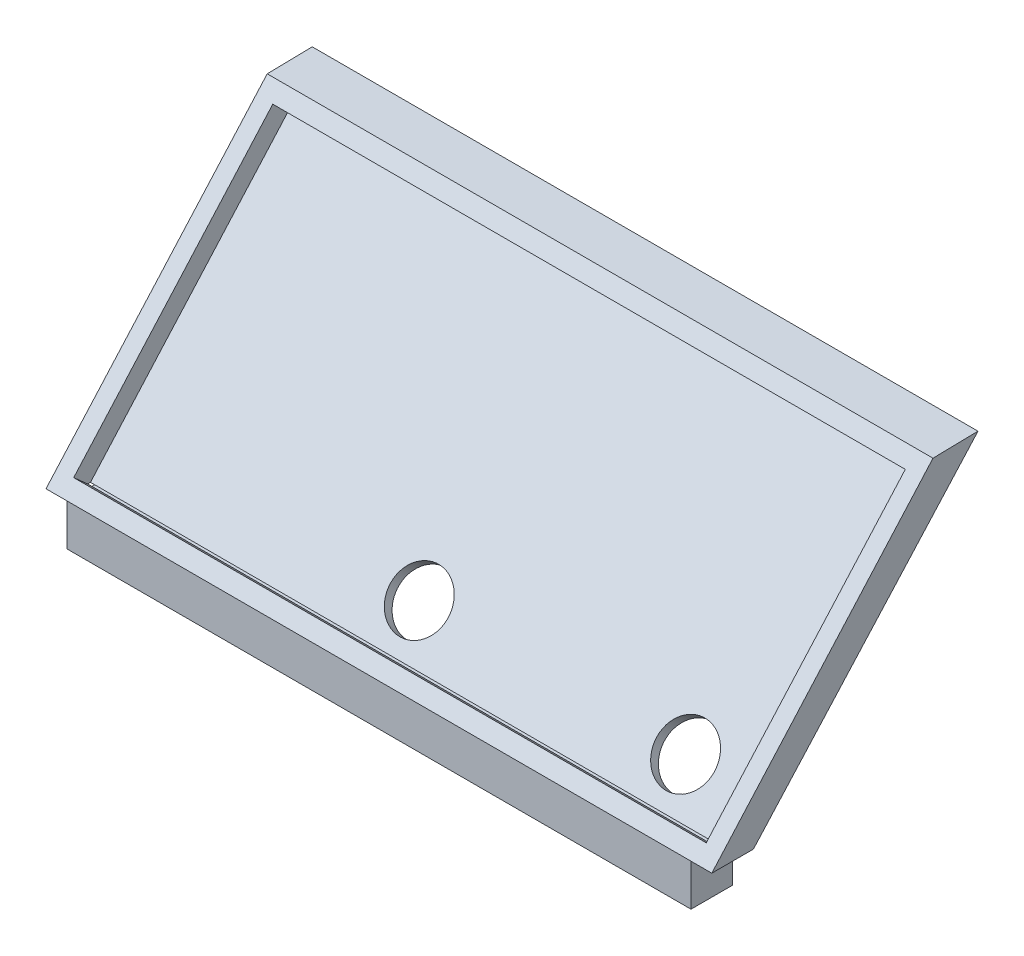
from build123d import *

# Parameters (mm, degrees)
SKETCH1_W            = 101.6
SKETCH1_H            = 50.8
BOSS_EXTRUDE1_DEPTH  = 228.6
SKETCH2_W            = 96.52
SKETCH2_H            = 172.72
CUT_EXTRUDE1_DEPTH   = 50.8
BOSS_EXTRUDE2_DEPTH  = 50.8
BOSS_EXTRUDE3_DEPTH  = 101.6
SKETCH13_W           = 96.52
SKETCH13_H           = 25.4
CUT_EXTRUDE2_DEPTH   = 50.8
SKETCH14_W           = 96.52
SKETCH14_H           = 25.4
CUT_EXTRUDE3_DEPTH   = 50.8
SKETCH15_W           = 96.52
SKETCH15_H           = 50.8
CUT_EXTRUDE6_DEPTH   = 6.35
SKETCH16_W           = 96.52
SKETCH16_H           = 45.72
CUT_EXTRUDE7_DEPTH   = 3.175
SKETCH17_W           = 101.6
SKETCH17_H           = 25.4
CUT_EXTRUDE8_DEPTH   = 228.6
SKETCH20_W           = 6.35
SKETCH20_H           = 12.7
BOSS_EXTRUDE5_DEPTH  = 101.6
SKETCH24_W           = 12.7
SKETCH24_H           = 6.35
BOSS_EXTRUDE8_DEPTH  = 19.05
SKETCH26_W           = 12.7
SKETCH26_H           = 6.35
BOSS_EXTRUDE10_DEPTH = 19.05
SKETCH27_W           = 12.7
SKETCH27_H           = 6.35
BOSS_EXTRUDE11_DEPTH = 19.05
SKETCH33_W           = 96.52
SKETCH33_H           = 2.54
BOSS_EXTRUDE13_DEPTH = 2.54
SKETCH34_W           = 96.52
SKETCH34_H           = 2.54
BOSS_EXTRUDE17_DEPTH = 2.54
SKETCH36_W           = 218.44
SKETCH36_H           = 2.54
BOSS_EXTRUDE18_DEPTH = 2.54
SKETCH37_W           = 218.44
SKETCH37_H           = 2.54
BOSS_EXTRUDE19_DEPTH = 2.54
SKETCH45_W           = 13.208
SKETCH45_H           = 10.16
CUT_EXTRUDE19_DEPTH  = 6.35
CUT_EXTRUDE22_START  = -101.6
CUT_EXTRUDE22_DEPTH  = 101.6
SKETCH60_R           = 4.445
CUT_EXTRUDE23_DEPTH  = 2.54
SKETCH61_R           = 4.445
CUT_EXTRUDE24_DEPTH  = 2.54
SKETCH64_W           = 95.25
SKETCH64_H           = 6.35
BOSS_EXTRUDE33_DEPTH = 6.35


# Read off the part's stored shape, not the designer's step: Cut-Extrude22
with BuildPart() as part:
    # Sketch1 → Boss-Extrude1 (new body)
    with BuildSketch(Plane.XY):
        Rectangle(SKETCH1_W, SKETCH1_H)
    extrude(amount=-BOSS_EXTRUDE1_DEPTH)

    # Sketch2 → Cut-Extrude1 (cut)
    with BuildSketch(Plane(origin=(0, 25.4, 0), x_dir=(1, 0, 0), z_dir=(0, 1, 0))):
        with Locations((0, 114.3)):
            Rectangle(SKETCH2_W, SKETCH2_H)
    extrude(amount=-CUT_EXTRUDE1_DEPTH, mode=Mode.SUBTRACT)

    # Sketch3 → Boss-Extrude2 (add)
    with BuildSketch(Plane(origin=(0, 25.4, 0), x_dir=(1, 0, 0), z_dir=(0, 1, 0))):
        Polygon((48.26, 73.001295984), (48.26, 79.351295984), (-48.26, 79.351295984), (-48.26, 73.001295984), (0, 73.001295984), align=None)
    extrude(amount=-BOSS_EXTRUDE2_DEPTH)

    # Sketch11 → Boss-Extrude3 (add)
    with BuildSketch(Plane.ZY.offset(50.8)):
        Polygon((-79.351295984, 25.4), (-113.622558301, 63.5), (-106.756614843, 63.363382999), (-73.001295984, 25.4), align=None)
    extrude(amount=-BOSS_EXTRUDE3_DEPTH)

    # Sketch13 → Cut-Extrude2 (cut)
    with BuildSketch(Plane(origin=(0, 25.4, 0), x_dir=(1, 0, 0), z_dir=(0, 1, 0))):
        with Locations((0, 213.36)):
            Rectangle(SKETCH13_W, SKETCH13_H)
    extrude(amount=-CUT_EXTRUDE2_DEPTH, mode=Mode.SUBTRACT)

    # Sketch14 → Cut-Extrude3 (cut)
    with BuildSketch(Plane(origin=(0, 25.4, 0), x_dir=(1, 0, 0), z_dir=(0, 1, 0))):
        with Locations((0, 15.24)):
            Rectangle(SKETCH14_W, SKETCH14_H)
    extrude(amount=-CUT_EXTRUDE3_DEPTH, mode=Mode.SUBTRACT)

    # Sketch15 → Cut-Extrude6 (cut)
    with BuildSketch(Plane.XY.offset(-73.001295984)):
        Rectangle(SKETCH15_W, SKETCH15_H)
    extrude(amount=-CUT_EXTRUDE6_DEPTH, mode=Mode.SUBTRACT)

    # Sketch16 → Cut-Extrude7 (cut)
    with BuildSketch(Plane(origin=(0, -25.035409247, -28.156416881), x_dir=(1, 0, 0), z_dir=(0, 0.6644747806949454, 0.7473106889509907))):
        with Locations((0, 92.889211639)):
            Rectangle(SKETCH16_W, SKETCH16_H)
    extrude(amount=-CUT_EXTRUDE7_DEPTH, mode=Mode.SUBTRACT)

    # Sketch17 → Cut-Extrude8 (cut)
    with BuildSketch(Plane.XY):
        with Locations((0, -12.7)):
            Rectangle(SKETCH17_W, SKETCH17_H)
    extrude(amount=-CUT_EXTRUDE8_DEPTH, mode=Mode.SUBTRACT)

    # Sketch20 → Boss-Extrude5 (add)
    with BuildSketch(Plane.ZY.offset(50.8)):
        with Locations((-174.625, 6.35)):
            Rectangle(SKETCH20_W, SKETCH20_H)
    extrude(amount=-BOSS_EXTRUDE5_DEPTH)

    # Sketch24 → Boss-Extrude8 (add)
    with BuildSketch(Plane.XZ):
        with Locations((44.45, -76.176295984)):
            Rectangle(SKETCH24_W, SKETCH24_H)
    extrude(amount=BOSS_EXTRUDE8_DEPTH)

    # Sketch26 → Boss-Extrude10 (add)
    with BuildSketch(Plane.XZ):
        with Locations((-44.45, -174.625)):
            Rectangle(SKETCH26_W, SKETCH26_H)
    extrude(amount=BOSS_EXTRUDE10_DEPTH)

    # Sketch27 → Boss-Extrude11 (add)
    with BuildSketch(Plane.XZ):
        with Locations((44.45, -174.625)):
            Rectangle(SKETCH27_W, SKETCH27_H)
    extrude(amount=BOSS_EXTRUDE11_DEPTH)

    # Sketch33 → Boss-Extrude13 (add)
    with BuildSketch(Plane(origin=(0, 0, -2.54), x_dir=(-1, 0, 0), z_dir=(0, 0, -1))):
        with Locations((0, 12.7)):
            Rectangle(SKETCH33_W, SKETCH33_H)
    extrude(amount=BOSS_EXTRUDE13_DEPTH)

    # Sketch34 → Boss-Extrude17 (add)
    with BuildSketch(Plane.XY.offset(-226.06)):
        with Locations((0, 12.7)):
            Rectangle(SKETCH34_W, SKETCH34_H)
    extrude(amount=BOSS_EXTRUDE17_DEPTH)

    # Sketch36 → Boss-Extrude18 (add)
    with BuildSketch(Plane(origin=(-48.26, 0, 0), x_dir=(0, 0, -1), z_dir=(1, 0, 0))):
        with Locations((114.3, 12.7)):
            Rectangle(SKETCH36_W, SKETCH36_H)
    extrude(amount=BOSS_EXTRUDE18_DEPTH)

    # Sketch37 → Boss-Extrude19 (add)
    with BuildSketch(Plane.ZY.offset(-48.26)):
        with Locations((-114.3, 12.7)):
            Rectangle(SKETCH37_W, SKETCH37_H)
    extrude(amount=BOSS_EXTRUDE19_DEPTH)

    # Sketch45 → Cut-Extrude19 (cut)
    with BuildSketch(Plane.XY):
        with Locations((37.933039121, 12.7)):
            Rectangle(SKETCH45_W, SKETCH45_H)
        with Locations((-37.933039121, 12.7)):
            Rectangle(SKETCH45_W, SKETCH45_H)
    extrude(amount=-CUT_EXTRUDE19_DEPTH, mode=Mode.SUBTRACT)

    # Cut-Extrude22 outline → Cut-Extrude22 (cut)
    with BuildSketch(Plane.ZY.offset(50.8).offset(CUT_EXTRUDE22_START)):
        Polygon((-73.001295984, 0), (0, 0), (0, 25.4), (-228.6, 25.4), (-228.6, 0), (-177.8, 0), (-177.8, -19.05), (-171.45, -19.05), (-171.45, 0), (-79.351295984, 0), (-79.351295984, -19.05), (-73.001295984, -19.05), align=None)
    extrude(amount=CUT_EXTRUDE22_DEPTH, mode=Mode.SUBTRACT)

    # Sketch60 → Cut-Extrude23 (cut)
    with BuildSketch(Plane(origin=(0, -27.145116675, -30.529128319), x_dir=(1, 0, 0), z_dir=(0, 0.6644747806949455, 0.7473106889509905))):
        with Locations(Location((38.1, 77.014211639, 0), (0, 0, 270))):
            Circle(SKETCH60_R)
    extrude(amount=-CUT_EXTRUDE23_DEPTH, mode=Mode.SUBTRACT)

    # Sketch61 → Cut-Extrude24 (cut)
    with BuildSketch(Plane(origin=(0, -27.145116675, -30.529128319), x_dir=(1, 0, 0), z_dir=(0, 0.6644747806949455, 0.7473106889509905))):
        with Locations(Location((-2.54, 77.014211639, 0), (0, 0, 270))):
            Circle(SKETCH61_R)
    extrude(amount=-CUT_EXTRUDE24_DEPTH, mode=Mode.SUBTRACT)

    # Sketch64 → Boss-Extrude33 (add)
    with BuildSketch(Plane(origin=(0, 25.4, 0), x_dir=(-1, 0, 0), z_dir=(0, -1, 0))):
        with Locations((0, 76.176295984)):
            Rectangle(SKETCH64_W, SKETCH64_H)
    extrude(amount=BOSS_EXTRUDE33_DEPTH)


solid = part.part
